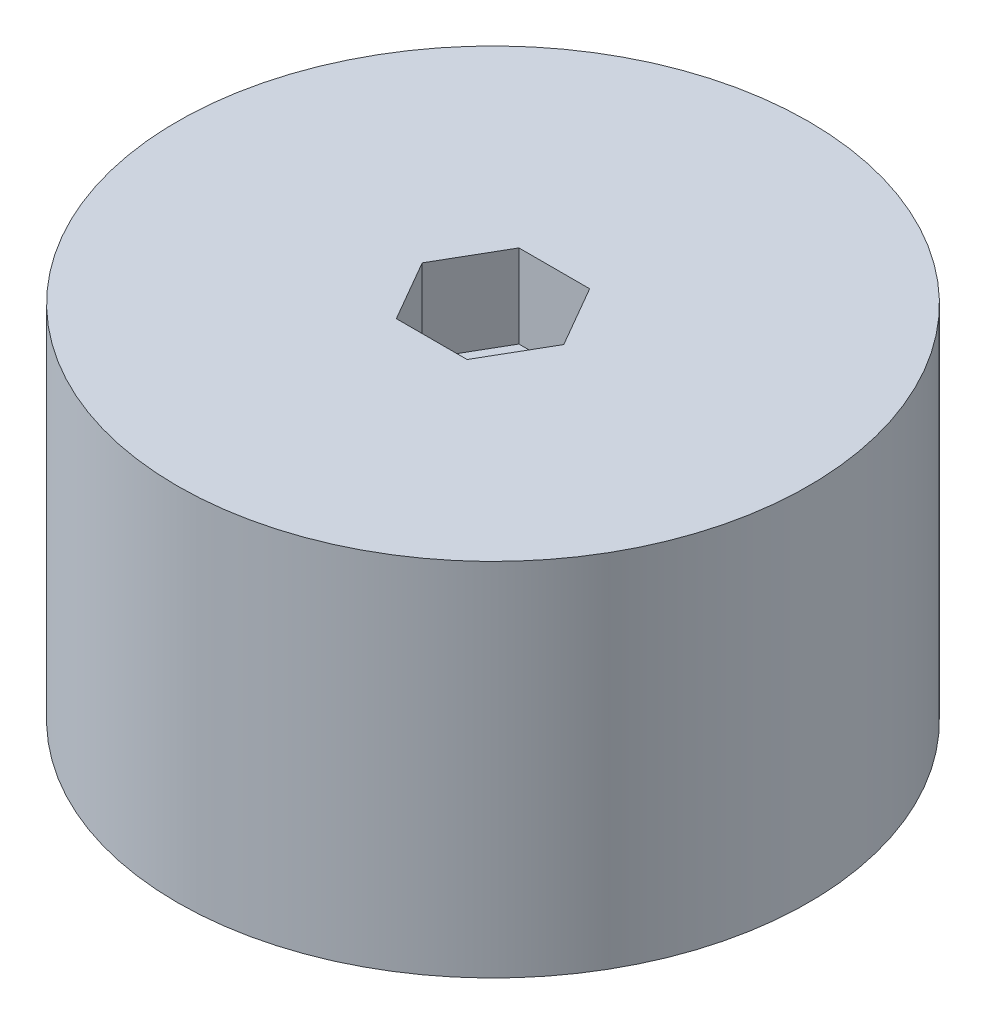
from build123d import *

# Parameters (mm, degrees)
SKETCH1_R           = 22.75
SKETCH1_R_2         = 2.15
BOSS_EXTRUDE1_DEPTH = 26
CUT_EXTRUDE1_DEPTH  = 6


with BuildPart() as part:
    # Sketch1 → Boss-Extrude1 (new body)
    with BuildSketch(Plane(origin=(0, 0, 0), x_dir=(1, 0, 0), z_dir=(0, 1, 0))):
        Circle(SKETCH1_R)
        Circle(SKETCH1_R_2, mode=Mode.SUBTRACT)
    extrude(amount=BOSS_EXTRUDE1_DEPTH)

    # Sketch2 → Cut-Extrude1 (cut)
    with BuildSketch(Plane(origin=(0, 26, 0), x_dir=(1, 0, 0), z_dir=(0, 1, 0))):
        Polygon((5.1, 0), (2.55, 4.416729559), (-2.55, 4.416729559), (-5.1, 0), (-2.55, -4.416729559), (2.55, -4.416729559), align=None)
    extrude(amount=-CUT_EXTRUDE1_DEPTH, mode=Mode.SUBTRACT)


solid = part.part
